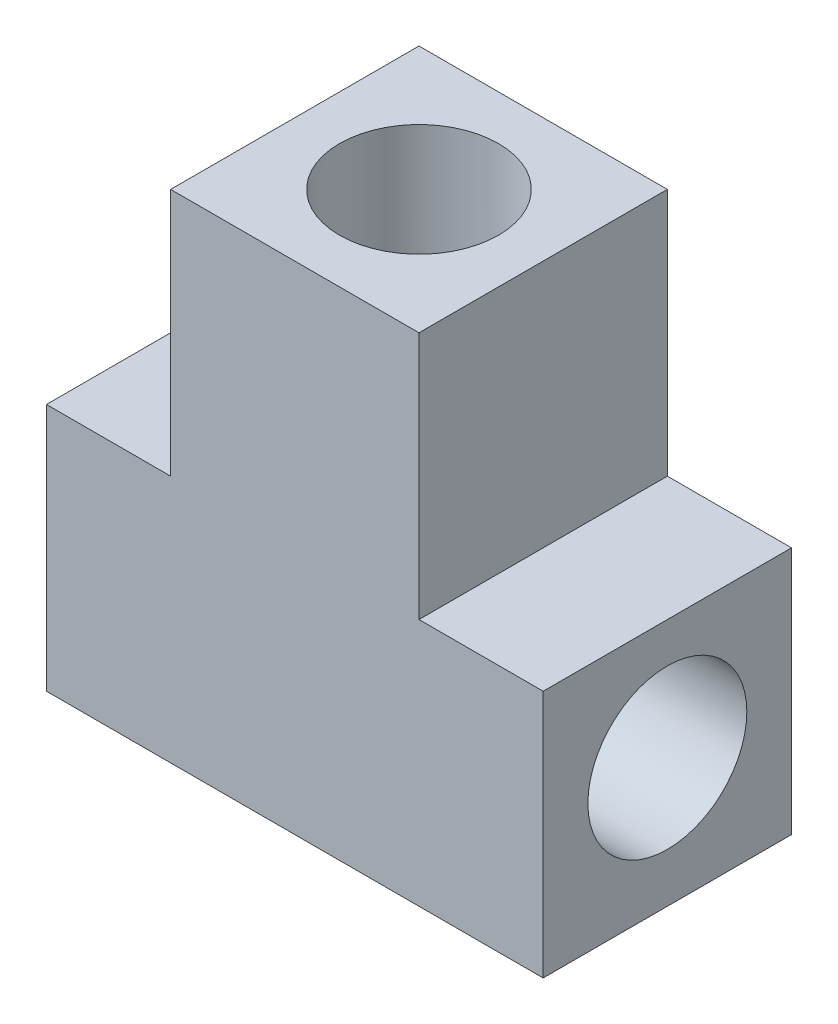
from build123d import *

# Parameters (mm, degrees)
CROQUIS2_W                 = 50
CROQUIS2_H                 = 25
SALIENTE_EXTRUIR2_DEPTH    = 25
CROQUIS9_W                 = 25
CROQUIS9_H                 = 25
SALIENTE_EXTRUIR3_DEPTH    = 50
CORTAR_EXTRUIR2_DEPTH      = 43
CORTAR_EXTRUIR2_DEPTH_BACK = 49
CROQUIS10_R                = 8
CROQUIS11_R                = 8
CORTAR_EXTRUIR3_DEPTH      = 37.5


with BuildPart() as part:
    # Croquis2 → Saliente-Extruir2 (new body)
    with BuildSketch(Plane(origin=(0, 0, 0), x_dir=(1, 0, 0), z_dir=(0, 1, 0))):
        Rectangle(CROQUIS2_W, CROQUIS2_H)
    extrude(amount=SALIENTE_EXTRUIR2_DEPTH)

    # Croquis9 → Saliente-Extruir3 (add)
    with BuildSketch(Plane(origin=(0, 0, 0), x_dir=(1, 0, 0), z_dir=(0, 1, 0))):
        Rectangle(CROQUIS9_W, CROQUIS9_H)
    extrude(amount=SALIENTE_EXTRUIR3_DEPTH)

    # Croquis10 → Cortar-Extruir2 (cut, two sides: drawn at the far end of the back side and taken through both)
    with BuildSketch(Plane(origin=(0, 0, 0), x_dir=(0, 0, -1), z_dir=(1, 0, 0)).offset(-CORTAR_EXTRUIR2_DEPTH_BACK)):
        with Locations((0, 12.957262023)):
            Circle(CROQUIS10_R)
    extrude(amount=CORTAR_EXTRUIR2_DEPTH + CORTAR_EXTRUIR2_DEPTH_BACK, mode=Mode.SUBTRACT)

    # Croquis11 → Cortar-Extruir3 (cut, symmetric)
    with BuildSketch(Plane(origin=(0, 50, 0), x_dir=(1, 0, 0), z_dir=(0, 1, 0))):
        Circle(CROQUIS11_R)
    extrude(amount=CORTAR_EXTRUIR3_DEPTH, both=True, mode=Mode.SUBTRACT)


solid = part.part
